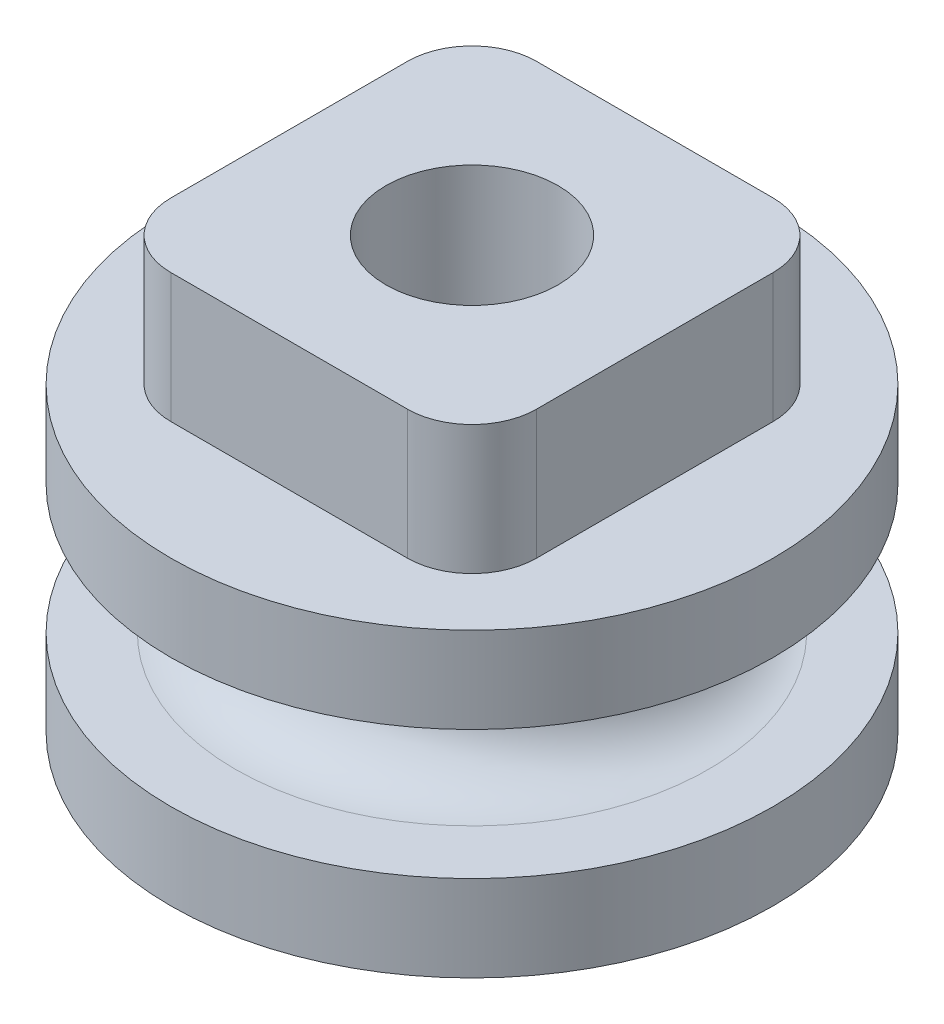
from build123d import *

# Parameters (mm, degrees)
SKETCH_2_R          = 2
CUT_EXTRUDE_1_DEPTH = 13.124355653
SKETCH_4_W          = 8.5
SKETCH_4_H          = 8.5
SKETCH_4_R          = 2
EXTRUDE_1_DEPTH     = 3
FILLET_1_R          = 1.5


with BuildPart() as part:
    # ｽｹｯﾁ1 → 回転1 (revolve)
    with BuildSketch(Plane.XY):
        with BuildLine():
            Line((0, 3.5), (-7, 3.5))
            Line((-7, 3.5), (-7, 1.5))
            Line((-7, 1.5), (-5.5, 1.5))
            ThreePointArc((-5.5, 1.5), (-4, 0), (-5.5, -1.5))
            Line((-5.5, -1.5), (-7, -1.5))
            Line((-7, -1.5), (-7, -3.5))
            Line((-7, -3.5), (0, -3.5))
            Line((0, -3.5), (0, 3.5))
        make_face()
    revolve(axis=Axis((0, 3.5, 0), (0, -1, 0)))

    # ｽｹｯﾁ2 → ｶｯﾄ - 押し出し1 (cut, through all)
    with BuildSketch(Plane.XZ.offset(3.5)):
        Circle(SKETCH_2_R)
    extrude(amount=-CUT_EXTRUDE_1_DEPTH, mode=Mode.SUBTRACT)

    # ｽｹｯﾁ4 → ﾎﾞｽ - 押し出し1 (add)
    with BuildSketch(Plane(origin=(0, 3.5, 0), x_dir=(1, 0, 0), z_dir=(0, 1, 0))):
        Rectangle(SKETCH_4_W, SKETCH_4_H)
        Circle(SKETCH_4_R, mode=Mode.SUBTRACT)
    extrude(amount=EXTRUDE_1_DEPTH)

    # ﾌｨﾚｯﾄ1
    fillet_1_edges = [part.edges().sort_by_distance(p)[0] for p in [
        (4.25, 5, -4.25),
        (4.25, 5, 4.25),
        (-4.25, 5, 4.25),
        (-4.25, 5, -4.25),
    ]]
    fillet(fillet_1_edges, radius=FILLET_1_R)


solid = part.part
